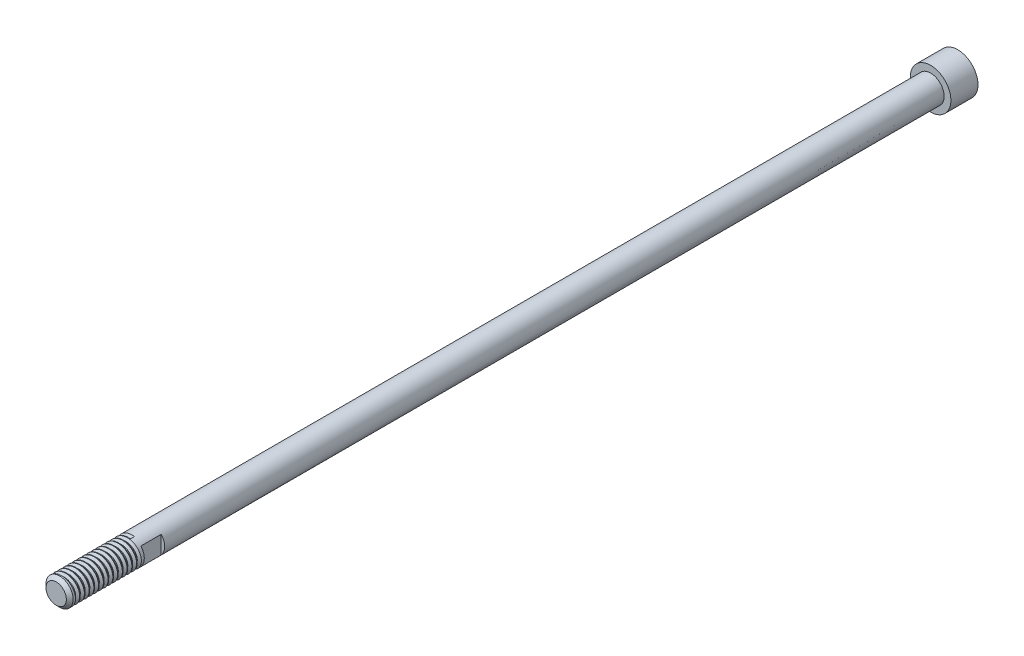
from build123d import *

# Parameters (mm, degrees)
SKETCH1_R           = 2.99
BOSS_EXTRUDE1_DEPTH = 4
SKETCH2_R           = 2
BOSS_EXTRUDE2_DEPTH = 118
SKETCH4_W           = 1.578573546
SKETCH4_H           = 4.037657963
CUT_EXTRUDE1_DEPTH  = 3
SKETCH5_R           = 2
BOSS_EXTRUDE3_DEPTH = 11
CHAMFER1_SIZE       = 0.5
THREAD2_PITCH       = 0.7


with BuildPart() as part:
    # Sketch1 → Boss-Extrude1 (new body)
    with BuildSketch(Plane.XY):
        Circle(SKETCH1_R)
    extrude(amount=BOSS_EXTRUDE1_DEPTH)

    # Sketch2 → Boss-Extrude2 (add)
    with BuildSketch(Plane.XY.offset(4)):
        Circle(SKETCH2_R)
    extrude(amount=BOSS_EXTRUDE2_DEPTH)

    # Sketch4 → Cut-Extrude1 (cut)
    with BuildSketch(Plane.XY.offset(122)):
        with Locations((-2.289286773, -0.027763856)):
            Rectangle(SKETCH4_W, SKETCH4_H)
        with Locations((2.289286773, -0.027763856)):
            Rectangle(SKETCH4_W, SKETCH4_H)
    extrude(amount=-CUT_EXTRUDE1_DEPTH, mode=Mode.SUBTRACT)

    # Sketch5 → Boss-Extrude3 (add)
    with BuildSketch(Plane.XY.offset(122)):
        Circle(SKETCH5_R)
    extrude(amount=BOSS_EXTRUDE3_DEPTH)

    # Chamfer1
    chamfer1_edges = [part.edges().sort_by_distance(p)[0] for p in [
        (-2, 0, 133),
    ]]
    chamfer(chamfer1_edges, length=CHAMFER1_SIZE)

    # Thread2: the profile of Thread Profile2 profile screwed along a right-hand helix of 14.285714 turns, 6 arcs to a turn; built about Z, then put on its axis
    thread2_z = Axis((0, 0, 0), (0, 0, 1))
    thread2_corners = [(2.0003, 0, -0.000173205), (2.0003, 0, 0.612673203), (1.621113887, 0, 0.393749999), (1.621113887, 0, 0.218749999)]
    with BuildLine(mode=Mode.PRIVATE) as thread2_profile:
        Line(thread2_corners[0], thread2_corners[1])
        Line(thread2_corners[1], thread2_corners[2])
        Line(thread2_corners[2], thread2_corners[3])
        Line(thread2_corners[3], thread2_corners[0])
    thread2_cap = Face(thread2_profile.wire())
    thread2_turn_angles = [0, 30, 60, 90, 120, 150, 180, 210, 240, 270, 300, 330, 360]
    thread2_turn_weights = [1, 0.8660254037844387, 1, 0.8660254037844387, 1, 0.8660254037844387, 1, 0.8660254037844387, 1, 0.8660254037844387, 1, 0.8660254037844387, 1]
    thread2_turn_rails = [Edge.make_bspline([Vector(p[0], p[1], 0).rotate(thread2_z, thread2_turn_angles[k]) / thread2_turn_weights[k] + Vector(0, 0, p[2] + THREAD2_PITCH * thread2_turn_angles[k] / 360) for k in range(13)], [0, 0, 0, 1, 1, 2, 2, 3, 3, 4, 4, 5, 5, 6, 6, 6], 2, thread2_turn_weights) for p in thread2_corners]
    thread2_turn_sides = [Face.make_surface_from_curves(thread2_turn_rails[p[0]], thread2_turn_rails[p[1]]) for p in [(0, 1), (1, 2), (2, 3), (3, 0)]]
    thread2_last_angles = [5040, 5070, 5100, 5121.428571429, 5142.857142857]
    thread2_last_weights = [1, 0.8660254037844387, 1, 0.9308737486442324, 1]
    thread2_last_rails = [Edge.make_bspline([Vector(p[0], p[1], 0).rotate(thread2_z, thread2_last_angles[k]) / thread2_last_weights[k] + Vector(0, 0, p[2] + THREAD2_PITCH * thread2_last_angles[k] / 360) for k in range(5)], [0, 0, 0, 1, 1, 2, 2, 2], 2, thread2_last_weights) for p in thread2_corners]
    thread2_last_sides = [Face.make_surface_from_curves(thread2_last_rails[p[0]], thread2_last_rails[p[1]]) for p in [(0, 1), (1, 2), (2, 3), (3, 0)]]
    thread2 = Plane(origin=(0, 0, 132.5), x_dir=(-1, 0, 0), z_dir=(0, 0, -1)) * Solid(Shell([*[p.moved(Location((0, 0, THREAD2_PITCH * i))) for i in range(14) for p in thread2_turn_sides], *thread2_last_sides, thread2_cap, thread2_cap.rotate(thread2_z, 5142.857142857).moved(Location((0, 0, THREAD2_PITCH * 5142.857142857 / 360)))]))
    add(thread2, mode=Mode.SUBTRACT)


solid = part.part
